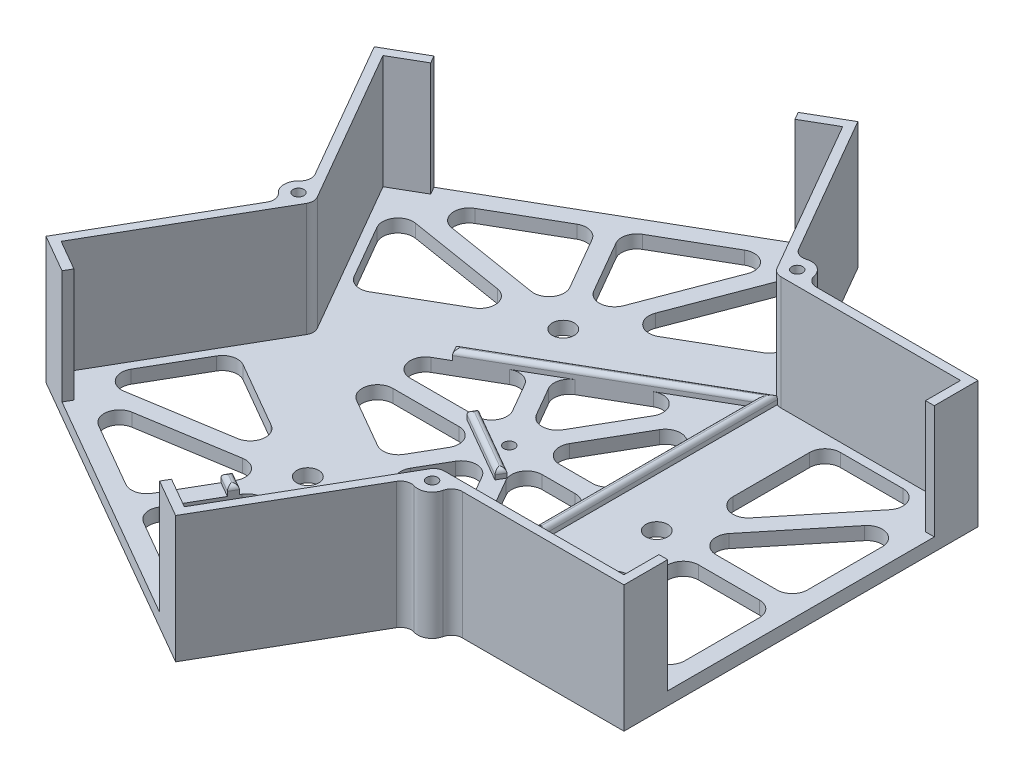
from build123d import *

# Parameters (mm, degrees)
SKETCH1_R           = 2.5
SKETCH1_R_2         = 1.25
SKETCH1_R_3         = 2.500000003
BOSS_EXTRUDE1_DEPTH = 3
SKETCH2_R           = 1.25
BOSS_EXTRUDE2_DEPTH = 26
CUT_EXTRUDE1_DEPTH  = 120.779947477
FILLET1_R           = 2.5
FILLET2_R           = 3.5
BOSS_EXTRUDE3_START = 2
BOSS_EXTRUDE3_DEPTH = 2
FILLET3_R           = 1


with BuildPart() as part:
    # Sketch1 → Boss-Extrude1 (new body)
    with BuildSketch(Plane(origin=(0, 0, 0), x_dir=(1, 0, 0), z_dir=(0, 1, 0))):
        Polygon((17.678998689, -38.883676018), (50.565771402, -38.883676018), (50.565771402, 42.116323982), (17.678998689, 42.116323982), (1.975114102, 51.182965976), (-14.468272255, 79.663746594), (-84.616329961, 39.163746594), (-68.172943605, 10.682965976), (-68.172943605, -7.450318011), (-84.616329961, -35.93109863), (-14.468272255, -76.43109863), (1.975114102, -47.950318011), align=None)
        Polygon((-36.879098195, -30.247787797), (-49.274351916, -51.716997015), (-75.622926864, -36.504640175), align=None, mode=Mode.SUBTRACT)
        Polygon((-33.41499658, -32.247787797), (-19.461675352, -68.929353854), (-45.810250301, -53.716997015), align=None, mode=Mode.SUBTRACT)
        Polygon((-65.652228346, -11.084311112), (-38.910005487, -26.523940679), (-78.232667252, -32.874270479), align=None, mode=Mode.SUBTRACT)
        with Locations(Location((-33.042301108, -27.602260305, 0), (0, 0, 270))):
            Circle(SKETCH1_R, mode=Mode.SUBTRACT)
        Polygon((-19.63704522, -0.383676018), (-28.199223084, -15.213803102), (-53.885756677, -0.383676018), align=None, mode=Mode.SUBTRACT)
        with Locations(Location((-16.17294368, 1.616323856, 0), (0, 0, 270))):
            Circle(SKETCH1_R_2, mode=Mode.SUBTRACT)
        Polygon((-29.174596729, -32.144681546), (-2.43237387, -47.584311112), (-15.012812776, -69.374270479), align=None, mode=Mode.SUBTRACT)
        Polygon((-16.172943605, -2.383676018), (0.951412124, -32.043930187), (-24.735121469, -17.213803102), align=None, mode=Mode.SUBTRACT)
        Polygon((-12.708841989, -0.383676018), (4.415513516, -0.383676018), (4.415513516, -30.043929801), align=None, mode=Mode.SUBTRACT)
        Polygon((19.565771402, -34.883676018), (19.565771402, -4.004416889), (44.726649214, -34.883676018), align=None, mode=Mode.SUBTRACT)
        Polygon((46.565771402, -0.383676018), (46.565771402, -30.808389697), (21.775263957, -0.383676018), align=None, mode=Mode.SUBTRACT)
        Polygon((-38.910005487, 29.756588643), (-65.652228346, 14.316959077), (-78.232667252, 36.106918444), align=None, mode=Mode.SUBTRACT)
        Polygon((-19.63704522, 3.616323982), (-53.885756241, 3.616323982), (-28.199222975, 18.446450878), align=None, mode=Mode.SUBTRACT)
        with Locations(Location((-33.042301108, 30.834908269, 0), (0, 0, 270))):
            Circle(SKETCH1_R, mode=Mode.SUBTRACT)
        Polygon((-36.879098195, 33.480435762), (-75.622926864, 39.73728814), (-49.274351916, 54.949644979), align=None, mode=Mode.SUBTRACT)
        Polygon((-19.461675352, 72.162001818), (-33.41499658, 35.480435762), (-45.810250301, 56.949644979), align=None, mode=Mode.SUBTRACT)
        Polygon((-12.708841989, 3.616323982), (4.415513516, 33.276577765), (4.415513516, 3.616323982), align=None, mode=Mode.SUBTRACT)
        Polygon((-16.172943605, 5.616323982), (-24.73512136, 20.446450878), (0.951411906, 35.276577773), align=None, mode=Mode.SUBTRACT)
        with Locations(Location((17.565771398, 1.616323983, 0), (0, 0, 270))):
            Circle(SKETCH1_R_3, mode=Mode.SUBTRACT)
        Polygon((21.775263957, 3.616323982), (46.565771402, 34.041037662), (46.565771402, 3.616323982), align=None, mode=Mode.SUBTRACT)
        Polygon((19.565771402, 7.237064853), (19.565771402, 38.116323982), (44.726649214, 38.116323982), align=None, mode=Mode.SUBTRACT)
        Polygon((-2.43237387, 50.816959077), (-29.174596729, 35.37732951), (-15.012812776, 72.606918444), align=None, mode=Mode.SUBTRACT)
    extrude(amount=BOSS_EXTRUDE1_DEPTH)

    # Sketch2 → Boss-Extrude2 (add)
    # profile 1 of 3: a face of its own
    with BuildSketch(Plane(origin=(0, 3, 0), x_dir=(1, 0, 0), z_dir=(0, 1, 0))):
        Polygon((-14.468272255, 79.663746594), (1.975114102, 51.182965976), (17.678998689, 42.116323982), (50.565771402, 42.116323982), (50.565771402, 32.116323982), (48.565771402, 32.116323982), (48.565771402, 40.116323982), (6.055041759, 40.116323982), (-15.200323062, 76.931695787), (-22.128526293, 72.931695787), (-23.128526293, 74.663746594), align=None)
        with Locations(Location((7.941049077, 43.382984481, 0), (0, 0, 90))):
            Circle(SKETCH2_R, mode=Mode.SUBTRACT)
    # profile 2 of 3: a face of its own
    with BuildSketch(Plane(origin=(0, 3, 0), x_dir=(1, 0, 0), z_dir=(0, 1, 0))):
        Polygon((50.565771402, -38.883676018), (17.678998689, -38.883676018), (1.975114102, -47.950318011), (-14.468272255, -76.43109863), (-23.128526293, -71.43109863), (-22.128526293, -69.699047822), (-15.200323062, -73.699047822), (6.055041759, -36.883676018), (48.565771402, -36.883676018), (48.565771402, -28.883676018), (50.565771402, -28.883676018), align=None)
        with Locations(Location((7.941049077, -40.150336516, 0), (0, 0, 90))):
            Circle(SKETCH2_R, mode=Mode.SUBTRACT)
    # profile 3 of 3: a face of its own
    with BuildSketch(Plane(origin=(0, 3, 0), x_dir=(1, 0, 0), z_dir=(0, 1, 0))):
        Polygon((-84.616329961, -35.93109863), (-68.172943605, -7.450318011), (-68.172943605, 10.682965976), (-84.616329961, 39.163746594), (-75.956075924, 44.163746594), (-74.956075924, 42.431695787), (-81.884279154, 38.431695787), (-60.628914332, 1.616323982), (-81.884279154, -35.199047822), (-74.956075924, -39.199047822), (-75.956075924, -40.93109863), align=None)
        with Locations(Location((-64.400928968, 1.616323982, 0), (0, 0, 90))):
            Circle(SKETCH2_R, mode=Mode.SUBTRACT)
    extrude(amount=BOSS_EXTRUDE2_DEPTH)

    # Sketch3 → Cut-Extrude1 (cut, through all)
    with BuildSketch(Plane(origin=(0, 29, 0), x_dir=(1, 0, 0), z_dir=(0, 1, 0))):
        with BuildLine():
            Line((-64.809512056, 4.857331645), (-68.172943605, 10.682965976))
            Line((-68.172943605, 10.682965976), (-68.172943605, -7.450318011))
            Line((-68.172943605, -7.450318011), (-64.809512056, -1.624683681))
            ThreePointArc((-64.809512056, -1.624683681), (-67.667589467, 1.616323982), (-64.809512056, 4.857331645))
        make_face()
        with BuildLine():
            Line((5.338545651, -42.124683681), (1.975114102, -47.950318011))
            Line((1.975114102, -47.950318011), (17.678998689, -38.883676018))
            Line((17.678998689, -38.883676018), (10.952135591, -38.883676018))
            ThreePointArc((10.952135591, -38.883676018), (11.143178695, -39.504243086), (11.207709576, -40.150336516))
            ThreePointArc((11.207709576, -40.150336516), (8.982580563, -43.246508827), (5.338545651, -42.124683681))
        make_face()
        with BuildLine():
            Line((10.952135591, 42.116323982), (17.678998689, 42.116323982))
            Line((17.678998689, 42.116323982), (1.975114102, 51.182965976))
            Line((1.975114102, 51.182965976), (5.338545651, 45.357331645))
            ThreePointArc((5.338545651, 45.357331645), (8.982580563, 46.479156791), (11.207709576, 43.382984481))
            ThreePointArc((11.207709576, 43.382984481), (11.143178696, 42.736891051), (10.952135591, 42.116323982))
        make_face()
    extrude(amount=-CUT_EXTRUDE1_DEPTH, mode=Mode.SUBTRACT)

    # Fillet1
    fillet1_edges = [part.edges().sort_by_distance(p)[0] for p in [
        (-60.628914332, 16, -1.616323982),
        (6.055041759, 16, -40.116323982),
        (6.055041759, 16, 36.883676018),
        (-64.809512056, 14.5, -4.857331645),
        (-64.809512056, 14.5, 1.624683681),
        (5.338545651, 14.5, 42.124683681),
        (10.952135591, 14.5, 38.883676018),
        (10.952135591, 14.5, -42.116323982),
        (5.338545651, 14.5, -45.357331645),
    ]]
    fillet(fillet1_edges, radius=FILLET1_R)

    # Fillet2
    fillet2_edges = [part.edges().sort_by_distance(p)[0] for p in [
        (-19.461675352, 1.5, 68.929353854),
        (-33.41499658, 1.5, 32.247787797),
        (-45.810250301, 1.5, 53.716997015),
        (-19.461675352, 1.5, -72.162001818),
        (-45.810250301, 1.5, -56.949644979),
        (-33.41499658, 1.5, -35.480435762),
        (46.565771402, 1.5, -34.041037662),
        (21.775263957, 1.5, -3.616323982),
        (46.565771402, 1.5, -3.616323982),
        (19.565771402, 1.5, 34.883676018),
        (44.726649214, 1.5, 34.883676018),
        (19.565771402, 1.5, 4.004416889),
        (-65.652228346, 1.5, -14.316959077),
        (-38.910005487, 1.5, -29.756588643),
        (-78.232667252, 1.5, -36.106918444),
        (-2.43237387, 1.5, -50.816959077),
        (-15.012812776, 1.5, -72.606918444),
        (-29.174596729, 1.5, -35.37732951),
        (19.565771402, 1.5, -38.116323982),
        (19.565771402, 1.5, -7.237064853),
        (44.726649214, 1.5, -38.116323982),
        (-2.43237387, 1.5, 47.584311112),
        (-29.174596729, 1.5, 32.144681546),
        (-15.012812776, 1.5, 69.374270479),
        (-65.652228346, 1.5, 11.084311112),
        (-78.232667252, 1.5, 32.874270479),
        (-38.910005487, 1.5, 26.523940679),
        (21.775263957, 1.5, 0.383676018),
        (46.565771402, 1.5, 30.808389697),
        (46.565771402, 1.5, 0.383676018),
        (-49.274351916, 1.5, -54.949644979),
        (-75.622926864, 1.5, -39.73728814),
        (-36.879098195, 1.5, -33.480435762),
        (-36.879098195, 1.5, 30.247787797),
        (-75.622926864, 1.5, 36.504640175),
        (-49.274351916, 1.5, 51.716997015),
        (-16.172943605, 1.5, 2.383676018),
        (-24.735121469, 1.5, 17.213803102),
        (0.951412124, 1.5, 32.043930187),
        (-19.63704522, 1.5, -3.616323982),
        (-28.199222975, 1.5, -18.446450878),
        (-53.885756241, 1.5, -3.616323982),
        (4.415513516, 1.5, 0.383676018),
        (-12.708841989, 1.5, 0.383676018),
        (4.415513516, 1.5, 30.043929801),
        (-28.199223084, 1.5, 15.213803102),
        (-19.63704522, 1.5, 0.383676018),
        (-53.885756677, 1.5, 0.383676018),
        (-24.73512136, 1.5, -20.446450878),
        (-16.172943605, 1.5, -5.616323982),
        (0.951411906, 1.5, -35.276577773),
        (-12.708841989, 1.5, -3.616323982),
        (4.415513516, 1.5, -3.616323982),
        (4.415513516, 1.5, -33.276577765),
    ]]
    fillet(fillet2_edges, radius=FILLET2_R)

    # Sketch4 → Boss-Extrude3 (add)
    with BuildSketch(Plane(origin=(0, 3, 0), x_dir=(1, 0, 0), z_dir=(0, 1, 0)).offset(BOSS_EXTRUDE3_START)):
        with BuildLine():
            ThreePointArc((6.415513516, 40.363033253), (6.24841743, 40.451260474), (6.088462372, 40.55185632))
            Line((6.088462372, 40.55185632), (-40.500115737, 13.653928207))
            Line((-40.500115737, 13.653928207), (-39.500115737, 11.921877399))
            Line((-39.500115737, 11.921877399), (4.415513516, 37.276577771))
            Line((4.415513516, 37.276577771), (4.415513516, -13.432822972))
            Line((4.415513516, -13.432822972), (6.415513516, -13.432822972))
            Line((6.415513516, -13.432822972), (6.415513516, 40.363033253))
        make_face()
        Polygon((-37.310250301, -38.99456515), (-40.774351916, -36.99456515), (-41.774351916, -38.726615958), (-38.310250301, -40.726615958), align=None)
        Polygon((-25.114475234, 3.616323982), (-26.114475234, 1.884273175), (-21.47251601, -0.795763233), (-15.612086206, -4.179283957), (-10.970126983, -6.859320365), (-9.970126983, -5.127269557), align=None)
    extrude(amount=-BOSS_EXTRUDE3_DEPTH)

    # Fillet3
    # the kernel refuses this fillet: 1 mm, written as the material it takes off along each edge
    with BuildSketch(Plane(origin=(8.253525882, 5, -41.80185632), x_dir=(0, -1, 0), z_dir=(-0.8660254037844387, 0, 0.5))) as fillet3_piece_1_section:
        with BuildLine():
            CenterArc((FILLET3_R, FILLET3_R), FILLET3_R, 180, 90)
            Line((0, FILLET3_R), (0, 0))
            Line((0, 0), (FILLET3_R, 0))
        make_face()
    fillet3_piece_1 = extrude(amount=58.795856225, mode=Mode.PRIVATE)
    fillet3_piece_1 = fillet3_piece_1 - Plane(origin=(7.498417432, 4.77393349, -42.616323982), x_dir=(0, 0, 1), z_dir=(0, 1, 0)) * Cylinder(2.5, 122, mode=Mode.PRIVATE)
    add(fillet3_piece_1, mode=Mode.SUBTRACT)
    with BuildSketch(Plane(origin=(-41.665179247, 5, -10.671877399), x_dir=(0, -1, 0), z_dir=(0.8660254037844376, 0, -0.5000000000000019))) as fillet3_piece_2_section:
        with BuildLine():
            CenterArc((FILLET3_R, FILLET3_R), FILLET3_R, 180, 90)
            Line((0, FILLET3_R), (0, 0))
            Line((0, 0), (FILLET3_R, 0))
        make_face()
    fillet3_piece_2 = extrude(amount=55.709400742, mode=Mode.PRIVATE)
    fillet3_piece_2 = split(fillet3_piece_2, bisect_by=Plane(origin=(4.415513516, 4.773902076, -24.203477099), z_dir=(-1, 0, 0)), keep=Keep.TOP, mode=Mode.PRIVATE)
    add(fillet3_piece_2, mode=Mode.SUBTRACT)
    with BuildSketch(Plane(origin=(6.415513516, 5, 15.932822972), x_dir=(0, -1, 0), z_dir=(0, 0, -1))) as fillet3_piece_3_section:
        with BuildLine():
            CenterArc((FILLET3_R, FILLET3_R), FILLET3_R, 180, 90)
            Line((0, FILLET3_R), (0, 0))
            Line((0, 0), (FILLET3_R, 0))
        make_face()
    fillet3_piece_3 = extrude(amount=58.795856225, mode=Mode.PRIVATE)
    fillet3_piece_3 = fillet3_piece_3 - Plane(origin=(7.498417432, 4.773933653, -42.616323982), x_dir=(0, 0, 1), z_dir=(0, 1, 0)) * Cylinder(2.5, 122, mode=Mode.PRIVATE)
    add(fillet3_piece_3, mode=Mode.SUBTRACT)
    with BuildSketch(Plane(origin=(4.415513516, 5, -39.776577771), x_dir=(0, -1, 0), z_dir=(0, 0, 1))) as fillet3_piece_4_section:
        with BuildLine():
            CenterArc((FILLET3_R, FILLET3_R), FILLET3_R, 180, 90)
            Line((0, FILLET3_R), (0, 0))
            Line((0, 0), (FILLET3_R, 0))
        make_face()
    fillet3_piece_4 = extrude(amount=55.709400742, mode=Mode.PRIVATE)
    fillet3_piece_4 = split(fillet3_piece_4, bisect_by=Plane(origin=(-6.906123772, 4.773902076, -30.740027435), z_dir=(0.5, 0, 0.8660254037844387)), keep=Keep.TOP, mode=Mode.PRIVATE)
    add(fillet3_piece_4, mode=Mode.SUBTRACT)
    with BuildSketch(Plane(origin=(-7.805063473, 5, 6.377269557), x_dir=(0, -1, 0), z_dir=(-0.8660254037844387, 0, -0.5000000000000001))) as fillet3_piece_5:
        with BuildLine():
            CenterArc((FILLET3_R, FILLET3_R), FILLET3_R, 180, 90)
            Line((0, FILLET3_R), (0, 0))
            Line((0, 0), (FILLET3_R, 0))
        make_face()
    extrude(amount=22.487187079, mode=Mode.SUBTRACT)
    with BuildSketch(Plane(origin=(-8.805063473, 5, 8.109320365), x_dir=(0, -1, 0), z_dir=(-0.8660254037844386, 0, -0.5000000000000002))) as fillet3_piece_6:
        with BuildLine():
            CenterArc((FILLET3_R, -FILLET3_R), FILLET3_R, 90, 90)
            Line((0, -FILLET3_R), (0, 0))
            Line((0, 0), (FILLET3_R, 0))
        make_face()
    extrude(amount=22.487187079, mode=Mode.SUBTRACT)
    with BuildSketch(Plane(origin=(-35.145186791, 5, 40.24456515), x_dir=(0, -1, 0), z_dir=(-0.8660254037844393, 0, -0.499999999999999)), Plane(origin=(-43.939415425, 5, 37.476615958), x_dir=(0, -1, 0), z_dir=(0.8660254037844393, 0, 0.499999999999999))) as fillet3_piece_7:
        with BuildLine():
            CenterArc((FILLET3_R, FILLET3_R), FILLET3_R, 180, 90)
            Line((0, FILLET3_R), (0, 0))
            Line((0, 0), (FILLET3_R, 0))
        make_face()
    extrude(amount=9, mode=Mode.SUBTRACT)
    with BuildSketch(Plane(origin=(-39.524351916, 5, 34.829501641), x_dir=(0, -1, 0), z_dir=(-0.49999999999999784, 0, 0.8660254037844399)), Plane(origin=(-39.560250301, 5, 42.891679467), x_dir=(0, -1, 0), z_dir=(0.5000000000000006, 0, -0.8660254037844384)), Plane(origin=(-12.220126983, 5, 9.024383874), x_dir=(0, -1, 0), z_dir=(0.5000000000000009, 0, -0.8660254037844383)), Plane(origin=(-23.864475234, 5, -5.781387492), x_dir=(0, -1, 0), z_dir=(-0.5000000000000003, 0, 0.8660254037844385)), Plane(origin=(-41.750115737, 5, -15.818991716), x_dir=(0, -1, 0), z_dir=(0.5000000000000037, 0, 0.8660254037844366)), Plane(origin=(1.915513516, 5, 13.432822972), x_dir=(0, -1, 0), z_dir=(1, 0, 0))) as fillet3_piece_8:
        with BuildLine():
            CenterArc((FILLET3_R, FILLET3_R), FILLET3_R, 180, 90)
            Line((0, FILLET3_R), (0, 0))
            Line((0, 0), (FILLET3_R, 0))
        make_face()
    extrude(amount=7, mode=Mode.SUBTRACT)
    with BuildSketch(Plane(origin=(4.415513516, 5, -39.776577771), x_dir=(0, -1, 0), z_dir=(0, 0, 1))) as fillet3_piece_9a_section:
        with BuildLine():
            CenterArc((FILLET3_R, FILLET3_R), FILLET3_R, 180, 90)
            Line((0, FILLET3_R), (0, 0))
            Line((0, 0), (FILLET3_R, 0))
        make_face()
    fillet3_piece_9a = extrude(amount=55.709400742, mode=Mode.PRIVATE)
    fillet3_piece_9a = split(fillet3_piece_9a, bisect_by=Plane(origin=(5.144965345, 4.766914217, -37.69772698), z_dir=(-0.5, 0, -0.8660254037844387)), keep=Keep.TOP, mode=Mode.PRIVATE)
    with BuildSketch(Plane(origin=(-41.665179247, 5, -10.671877399), x_dir=(0, -1, 0), z_dir=(0.8660254037844376, 0, -0.5000000000000019))) as fillet3_piece_9b_section:
        with BuildLine():
            CenterArc((FILLET3_R, FILLET3_R), FILLET3_R, 180, 90)
            Line((0, FILLET3_R), (0, 0))
            Line((0, 0), (FILLET3_R, 0))
        make_face()
    fillet3_piece_9b = extrude(amount=55.709400742, mode=Mode.PRIVATE)
    fillet3_piece_9b = split(fillet3_piece_9b, bisect_by=Plane(origin=(4.415513516, 4.766914217, -38.118876189), z_dir=(1, 0, 0)), keep=Keep.TOP, mode=Mode.PRIVATE)
    fillet3_piece_9 = fillet3_piece_9a & fillet3_piece_9b
    add(fillet3_piece_9, mode=Mode.SUBTRACT)


solid = part.part
